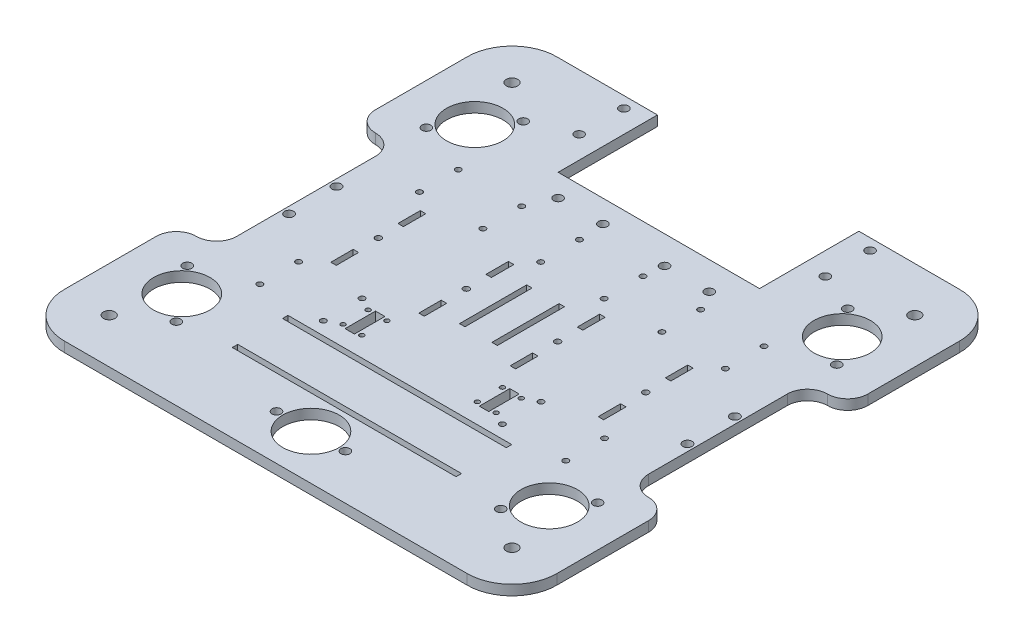
from build123d import *

# Parameters (mm, degrees)
SKETCH1_W                              = 279.4
SKETCH1_H                              = 279.4
BOSS_EXTRUDE1_DEPTH                    = 5.715
TAPE_SENSOR_CUTOUTS_CUT_EXTRUDE1_REACH = 199.648
SKETCH2_R                              = 1.2999974
SKETCH2_W                              = 5.334
SKETCH2_H                              = 17.272
WHEEL_WELLS_CUT_EXTRUDE2_REACH         = 199.648
SKETCH4_W                              = 22.86
SKETCH4_H                              = 101.6
FILLET1_START                          = -1
FILLET1_DEPTH                          = 8
FILLET1_2_DEPTH                        = 5.715
MOTOR_MOUNT_CUTOUTS_CUT_EXTRUDE3_REACH = 199.648
SKETCH5_W                              = 3.0988
SKETCH5_H                              = 12.7
SHAFT_HOLES_CUT_EXTRUDE4_REACH         = 199.648
SKETCH6_R                              = 3.2639
FILLET2_R                              = 25.4
COLLECTOR_CUTOUT_CUT_EXTRUDE5_REACH    = 199.648
SKETCH7_W                              = 114.3
SKETCH7_H                              = 56.388
F_6_0_204_DIAMETER_HOLE1_D             = 5.1816
M3_CLEARANCE_HOLE2_D                   = 3.4
CUT_EXTRUDE6_REACH                     = 199.648
SKETCH15_R                             = 2.54
SKETCH15_R_2                           = 16
SKETCH15_R_3                           = 16.000000004
CUT_EXTRUDE7_REACH                     = 199.648
SKETCH16_W                             = 3.0988
SKETCH16_H                             = 38.1
SKETCH19_R                             = 2.54
CUT_EXTRUDE8_DEPTH                     = 198.648276555
SKETCH20_R                             = 1.60655
SKETCH20_R_2                           = 1.59512
CUT_EXTRUDE9_DEPTH                     = 198.648276555
SKETCH25_W                             = 127
SKETCH25_H                             = 3.0988
CUT_EXTRUDE10_DEPTH                    = 198.648276555


with BuildPart() as part:
    # Sketch1 → Boss-Extrude1 (new body)
    with BuildSketch(Plane(origin=(0, 0, 0), x_dir=(1, 0, 0), z_dir=(0, 1, 0))):
        Rectangle(SKETCH1_W, SKETCH1_H)
    extrude(amount=BOSS_EXTRUDE1_DEPTH)

    # Sketch2 → TAPE_SENSOR_CUTOUTS_Cut-Extrude1 (cut, up to next)
    with BuildSketch(Plane(origin=(0, 5.715, 0), x_dir=(1, 0, 0), z_dir=(0, 1, 0)), mode=Mode.PRIVATE) as tape_sensor_cutouts_cut_extrude1_sk1:
        with Locations(Location((-43.434, -38.227, 0), (0, 0, 270))):
            Circle(SKETCH2_R)
    tape_sensor_cutouts_cut_extrude1_tool1 = extrude(tape_sensor_cutouts_cut_extrude1_sk1.sketch, amount=-TAPE_SENSOR_CUTOUTS_CUT_EXTRUDE1_REACH, mode=Mode.PRIVATE) & part.part
    # Sketch2 → TAPE_SENSOR_CUTOUTS_Cut-Extrude1 (cut, up to next)
    with BuildSketch(Plane(origin=(0, 5.715, 0), x_dir=(1, 0, 0), z_dir=(0, 1, 0)), mode=Mode.PRIVATE) as tape_sensor_cutouts_cut_extrude1_sk2:
        with Locations(Location((-32.766, -38.227, 0), (0, 0, 270))):
            Circle(SKETCH2_R)
    tape_sensor_cutouts_cut_extrude1_tool2 = extrude(tape_sensor_cutouts_cut_extrude1_sk2.sketch, amount=-TAPE_SENSOR_CUTOUTS_CUT_EXTRUDE1_REACH, mode=Mode.PRIVATE) & part.part
    # Sketch2 → TAPE_SENSOR_CUTOUTS_Cut-Extrude1 (cut, up to next)
    with BuildSketch(Plane(origin=(0, 5.715, 0), x_dir=(1, 0, 0), z_dir=(0, 1, 0)), mode=Mode.PRIVATE) as tape_sensor_cutouts_cut_extrude1_sk3:
        with Locations(Location((-32.766, -52.451, 0), (0, 0, 270))):
            Circle(SKETCH2_R)
    tape_sensor_cutouts_cut_extrude1_tool3 = extrude(tape_sensor_cutouts_cut_extrude1_sk3.sketch, amount=-TAPE_SENSOR_CUTOUTS_CUT_EXTRUDE1_REACH, mode=Mode.PRIVATE) & part.part
    # Sketch2 → TAPE_SENSOR_CUTOUTS_Cut-Extrude1 (cut, up to next)
    with BuildSketch(Plane(origin=(0, 5.715, 0), x_dir=(1, 0, 0), z_dir=(0, 1, 0)), mode=Mode.PRIVATE) as tape_sensor_cutouts_cut_extrude1_sk4:
        with Locations(Location((-43.434, -52.451, 0), (0, 0, 270))):
            Circle(SKETCH2_R)
    tape_sensor_cutouts_cut_extrude1_tool4 = extrude(tape_sensor_cutouts_cut_extrude1_sk4.sketch, amount=-TAPE_SENSOR_CUTOUTS_CUT_EXTRUDE1_REACH, mode=Mode.PRIVATE) & part.part
    # Sketch2 → TAPE_SENSOR_CUTOUTS_Cut-Extrude1 (cut, up to next)
    with BuildSketch(Plane(origin=(0, 5.715, 0), x_dir=(1, 0, 0), z_dir=(0, 1, 0)), mode=Mode.PRIVATE) as tape_sensor_cutouts_cut_extrude1_sk5:
        with Locations(Location((43.434, -52.451, 0), (0, 0, 270))):
            Circle(SKETCH2_R)
    tape_sensor_cutouts_cut_extrude1_tool5 = extrude(tape_sensor_cutouts_cut_extrude1_sk5.sketch, amount=-TAPE_SENSOR_CUTOUTS_CUT_EXTRUDE1_REACH, mode=Mode.PRIVATE) & part.part
    # Sketch2 → TAPE_SENSOR_CUTOUTS_Cut-Extrude1 (cut, up to next)
    with BuildSketch(Plane(origin=(0, 5.715, 0), x_dir=(1, 0, 0), z_dir=(0, 1, 0)), mode=Mode.PRIVATE) as tape_sensor_cutouts_cut_extrude1_sk6:
        with Locations(Location((32.766, -52.451, 0), (0, 0, 270))):
            Circle(SKETCH2_R)
    tape_sensor_cutouts_cut_extrude1_tool6 = extrude(tape_sensor_cutouts_cut_extrude1_sk6.sketch, amount=-TAPE_SENSOR_CUTOUTS_CUT_EXTRUDE1_REACH, mode=Mode.PRIVATE) & part.part
    # Sketch2 → TAPE_SENSOR_CUTOUTS_Cut-Extrude1 (cut, up to next)
    with BuildSketch(Plane(origin=(0, 5.715, 0), x_dir=(1, 0, 0), z_dir=(0, 1, 0)), mode=Mode.PRIVATE) as tape_sensor_cutouts_cut_extrude1_sk7:
        with Locations(Location((32.766, -38.227, 0), (0, 0, 270))):
            Circle(SKETCH2_R)
    tape_sensor_cutouts_cut_extrude1_tool7 = extrude(tape_sensor_cutouts_cut_extrude1_sk7.sketch, amount=-TAPE_SENSOR_CUTOUTS_CUT_EXTRUDE1_REACH, mode=Mode.PRIVATE) & part.part
    # Sketch2 → TAPE_SENSOR_CUTOUTS_Cut-Extrude1 (cut, up to next)
    with BuildSketch(Plane(origin=(0, 5.715, 0), x_dir=(1, 0, 0), z_dir=(0, 1, 0)), mode=Mode.PRIVATE) as tape_sensor_cutouts_cut_extrude1_sk8:
        with Locations(Location((43.434, -38.227, 0), (0, 0, 270))):
            Circle(SKETCH2_R)
    tape_sensor_cutouts_cut_extrude1_tool8 = extrude(tape_sensor_cutouts_cut_extrude1_sk8.sketch, amount=-TAPE_SENSOR_CUTOUTS_CUT_EXTRUDE1_REACH, mode=Mode.PRIVATE) & part.part
    # Sketch2 → TAPE_SENSOR_CUTOUTS_Cut-Extrude1 (cut, up to next)
    with BuildSketch(Plane(origin=(0, 5.715, 0), x_dir=(1, 0, 0), z_dir=(0, 1, 0)), mode=Mode.PRIVATE) as tape_sensor_cutouts_cut_extrude1_sk9:
        with Locations((-38.1, -45.339)):
            Rectangle(SKETCH2_W, SKETCH2_H)
    tape_sensor_cutouts_cut_extrude1_tool9 = extrude(tape_sensor_cutouts_cut_extrude1_sk9.sketch, amount=-TAPE_SENSOR_CUTOUTS_CUT_EXTRUDE1_REACH, mode=Mode.PRIVATE) & part.part
    # Sketch2 → TAPE_SENSOR_CUTOUTS_Cut-Extrude1 (cut, up to next)
    with BuildSketch(Plane(origin=(0, 5.715, 0), x_dir=(1, 0, 0), z_dir=(0, 1, 0)), mode=Mode.PRIVATE) as tape_sensor_cutouts_cut_extrude1_sk10:
        with Locations((38.1, -45.339)):
            Rectangle(SKETCH2_W, SKETCH2_H)
    tape_sensor_cutouts_cut_extrude1_tool10 = extrude(tape_sensor_cutouts_cut_extrude1_sk10.sketch, amount=-TAPE_SENSOR_CUTOUTS_CUT_EXTRUDE1_REACH, mode=Mode.PRIVATE) & part.part
    add(tape_sensor_cutouts_cut_extrude1_tool1.solids().sort_by_distance((-43.434, 5.715, 38.227))[0], mode=Mode.SUBTRACT)
    add(tape_sensor_cutouts_cut_extrude1_tool2.solids().sort_by_distance((-32.766, 5.715, 38.227))[0], mode=Mode.SUBTRACT)
    add(tape_sensor_cutouts_cut_extrude1_tool3.solids().sort_by_distance((-32.766, 5.715, 52.451))[0], mode=Mode.SUBTRACT)
    add(tape_sensor_cutouts_cut_extrude1_tool4.solids().sort_by_distance((-43.434, 5.715, 52.451))[0], mode=Mode.SUBTRACT)
    add(tape_sensor_cutouts_cut_extrude1_tool5.solids().sort_by_distance((43.434, 5.715, 52.451))[0], mode=Mode.SUBTRACT)
    add(tape_sensor_cutouts_cut_extrude1_tool6.solids().sort_by_distance((32.766, 5.715, 52.451))[0], mode=Mode.SUBTRACT)
    add(tape_sensor_cutouts_cut_extrude1_tool7.solids().sort_by_distance((32.766, 5.715, 38.227))[0], mode=Mode.SUBTRACT)
    add(tape_sensor_cutouts_cut_extrude1_tool8.solids().sort_by_distance((43.434, 5.715, 38.227))[0], mode=Mode.SUBTRACT)
    add(tape_sensor_cutouts_cut_extrude1_tool9.solids().sort_by_distance((-38.1, 5.715, 45.339))[0], mode=Mode.SUBTRACT)
    add(tape_sensor_cutouts_cut_extrude1_tool10.solids().sort_by_distance((38.1, 5.715, 45.339))[0], mode=Mode.SUBTRACT)

    # Sketch4 → WHEEL_WELLS_Cut-Extrude2 (cut, up to next)
    with BuildSketch(Plane(origin=(0, 5.715, 0), x_dir=(1, 0, 0), z_dir=(0, 1, 0)), mode=Mode.PRIVATE) as wheel_wells_cut_extrude2_sk1:
        with Locations((-128.27, 0)):
            Rectangle(SKETCH4_W, SKETCH4_H)
    wheel_wells_cut_extrude2_tool1 = extrude(wheel_wells_cut_extrude2_sk1.sketch, amount=-WHEEL_WELLS_CUT_EXTRUDE2_REACH, mode=Mode.PRIVATE) & part.part
    # Sketch4 → WHEEL_WELLS_Cut-Extrude2 (cut, up to next)
    with BuildSketch(Plane(origin=(0, 5.715, 0), x_dir=(1, 0, 0), z_dir=(0, 1, 0)), mode=Mode.PRIVATE) as wheel_wells_cut_extrude2_sk2:
        with Locations((128.27, 0)):
            Rectangle(SKETCH4_W, SKETCH4_H)
    wheel_wells_cut_extrude2_tool2 = extrude(wheel_wells_cut_extrude2_sk2.sketch, amount=-WHEEL_WELLS_CUT_EXTRUDE2_REACH, mode=Mode.PRIVATE) & part.part
    add(wheel_wells_cut_extrude2_tool1.solids().sort_by_distance((-128.27, 5.715, 0))[0], mode=Mode.SUBTRACT)
    add(wheel_wells_cut_extrude2_tool2.solids().sort_by_distance((128.27, 5.715, 0))[0], mode=Mode.SUBTRACT)

    # Fillet1: read off the stored shape, not the designer's step
    # Fillet1 outline → Fillet1 (cut)
    with BuildSketch(Plane(origin=(0, 0, 0), x_dir=(1, 0, 0), z_dir=(0, 1, 0)).offset(FILLET1_START)):
        with BuildLine():
            ThreePointArc((-139.7, -62.23), (-136.352230509, -54.147769491), (-128.27, -50.8))
            Line((-128.27, -50.8), (-139.7, -50.8))
            Line((-139.7, -50.8), (-139.7, -62.23))
        make_face()
        with BuildLine():
            ThreePointArc((-128.27, 50.8), (-136.352230509, 54.147769491), (-139.7, 62.23))
            Line((-139.7, 62.23), (-139.7, 50.8))
            Line((-139.7, 50.8), (-128.27, 50.8))
        make_face()
        with BuildLine():
            Line((139.7, -50.8), (128.27, -50.8))
            ThreePointArc((128.27, -50.8), (136.352230509, -54.147769491), (139.7, -62.23))
            Line((139.7, -62.23), (139.7, -50.8))
        make_face()
        with BuildLine():
            ThreePointArc((139.7, 62.23), (136.352230509, 54.147769491), (128.27, 50.8))
            Line((128.27, 50.8), (139.7, 50.8))
            Line((139.7, 50.8), (139.7, 62.23))
        make_face()
    extrude(amount=FILLET1_DEPTH, mode=Mode.SUBTRACT)

    # Fillet1 2 outline → Fillet1 2 (add)
    with BuildSketch(Plane(origin=(0, 0, 0), x_dir=(1, 0, 0), z_dir=(0, 1, 0))):
        with BuildLine():
            Line((-116.84, -50.8), (-116.84, -39.37))
            ThreePointArc((-116.84, -39.37), (-120.187769491, -47.452230509), (-128.27, -50.8))
            Line((-128.27, -50.8), (-116.84, -50.8))
        make_face()
        with BuildLine():
            Line((-116.84, 50.8), (-128.27, 50.8))
            ThreePointArc((-128.27, 50.8), (-120.187769491, 47.452230509), (-116.84, 39.37))
            Line((-116.84, 39.37), (-116.84, 50.8))
        make_face()
        with BuildLine():
            Line((116.84, -50.8), (128.27, -50.8))
            ThreePointArc((128.27, -50.8), (120.187769491, -47.452230509), (116.84, -39.37))
            Line((116.84, -39.37), (116.84, -50.8))
        make_face()
        with BuildLine():
            Line((116.84, 50.8), (116.84, 39.37))
            ThreePointArc((116.84, 39.37), (120.187769491, 47.452230509), (128.27, 50.8))
            Line((128.27, 50.8), (116.84, 50.8))
        make_face()
    extrude(amount=FILLET1_2_DEPTH)

    # Sketch5 → MOTOR_MOUNT_CUTOUTS_Cut-Extrude3 (cut, up to next)
    with BuildSketch(Plane(origin=(0, 0, 0), x_dir=(-1, 0, 0), z_dir=(0, -1, 0)), mode=Mode.PRIVATE) as motor_mount_cutouts_cut_extrude3_sk1:
        with Locations((75.8825, -19.05)):
            Rectangle(SKETCH5_W, SKETCH5_H)
    motor_mount_cutouts_cut_extrude3_tool1 = extrude(motor_mount_cutouts_cut_extrude3_sk1.sketch, amount=-MOTOR_MOUNT_CUTOUTS_CUT_EXTRUDE3_REACH, mode=Mode.PRIVATE) & part.part
    # Sketch5 → MOTOR_MOUNT_CUTOUTS_Cut-Extrude3 (cut, up to next)
    with BuildSketch(Plane(origin=(0, 0, 0), x_dir=(-1, 0, 0), z_dir=(0, -1, 0)), mode=Mode.PRIVATE) as motor_mount_cutouts_cut_extrude3_sk2:
        with Locations((75.8825, 19.05)):
            Rectangle(SKETCH5_W, SKETCH5_H)
    motor_mount_cutouts_cut_extrude3_tool2 = extrude(motor_mount_cutouts_cut_extrude3_sk2.sketch, amount=-MOTOR_MOUNT_CUTOUTS_CUT_EXTRUDE3_REACH, mode=Mode.PRIVATE) & part.part
    # Sketch5 → MOTOR_MOUNT_CUTOUTS_Cut-Extrude3 (cut, up to next)
    with BuildSketch(Plane(origin=(0, 0, 0), x_dir=(-1, 0, 0), z_dir=(0, -1, 0)), mode=Mode.PRIVATE) as motor_mount_cutouts_cut_extrude3_sk3:
        with Locations((-75.8825, 19.05)):
            Rectangle(SKETCH5_W, SKETCH5_H)
    motor_mount_cutouts_cut_extrude3_tool3 = extrude(motor_mount_cutouts_cut_extrude3_sk3.sketch, amount=-MOTOR_MOUNT_CUTOUTS_CUT_EXTRUDE3_REACH, mode=Mode.PRIVATE) & part.part
    # Sketch5 → MOTOR_MOUNT_CUTOUTS_Cut-Extrude3 (cut, up to next)
    with BuildSketch(Plane(origin=(0, 0, 0), x_dir=(-1, 0, 0), z_dir=(0, -1, 0)), mode=Mode.PRIVATE) as motor_mount_cutouts_cut_extrude3_sk4:
        with Locations((-75.8825, -19.05)):
            Rectangle(SKETCH5_W, SKETCH5_H)
    motor_mount_cutouts_cut_extrude3_tool4 = extrude(motor_mount_cutouts_cut_extrude3_sk4.sketch, amount=-MOTOR_MOUNT_CUTOUTS_CUT_EXTRUDE3_REACH, mode=Mode.PRIVATE) & part.part
    # Sketch5 → MOTOR_MOUNT_CUTOUTS_Cut-Extrude3 (cut, up to next)
    with BuildSketch(Plane(origin=(0, 0, 0), x_dir=(-1, 0, 0), z_dir=(0, -1, 0)), mode=Mode.PRIVATE) as motor_mount_cutouts_cut_extrude3_sk5:
        with Locations((25.908, -19.05)):
            Rectangle(SKETCH5_W, SKETCH5_H)
    motor_mount_cutouts_cut_extrude3_tool5 = extrude(motor_mount_cutouts_cut_extrude3_sk5.sketch, amount=-MOTOR_MOUNT_CUTOUTS_CUT_EXTRUDE3_REACH, mode=Mode.PRIVATE) & part.part
    # Sketch5 → MOTOR_MOUNT_CUTOUTS_Cut-Extrude3 (cut, up to next)
    with BuildSketch(Plane(origin=(0, 0, 0), x_dir=(-1, 0, 0), z_dir=(0, -1, 0)), mode=Mode.PRIVATE) as motor_mount_cutouts_cut_extrude3_sk6:
        with Locations((25.908, 19.05)):
            Rectangle(SKETCH5_W, SKETCH5_H)
    motor_mount_cutouts_cut_extrude3_tool6 = extrude(motor_mount_cutouts_cut_extrude3_sk6.sketch, amount=-MOTOR_MOUNT_CUTOUTS_CUT_EXTRUDE3_REACH, mode=Mode.PRIVATE) & part.part
    # Sketch5 → MOTOR_MOUNT_CUTOUTS_Cut-Extrude3 (cut, up to next)
    with BuildSketch(Plane(origin=(0, 0, 0), x_dir=(-1, 0, 0), z_dir=(0, -1, 0)), mode=Mode.PRIVATE) as motor_mount_cutouts_cut_extrude3_sk7:
        with Locations((-25.908, 19.05)):
            Rectangle(SKETCH5_W, SKETCH5_H)
    motor_mount_cutouts_cut_extrude3_tool7 = extrude(motor_mount_cutouts_cut_extrude3_sk7.sketch, amount=-MOTOR_MOUNT_CUTOUTS_CUT_EXTRUDE3_REACH, mode=Mode.PRIVATE) & part.part
    # Sketch5 → MOTOR_MOUNT_CUTOUTS_Cut-Extrude3 (cut, up to next)
    with BuildSketch(Plane(origin=(0, 0, 0), x_dir=(-1, 0, 0), z_dir=(0, -1, 0)), mode=Mode.PRIVATE) as motor_mount_cutouts_cut_extrude3_sk8:
        with Locations((-25.908, -19.05)):
            Rectangle(SKETCH5_W, SKETCH5_H)
    motor_mount_cutouts_cut_extrude3_tool8 = extrude(motor_mount_cutouts_cut_extrude3_sk8.sketch, amount=-MOTOR_MOUNT_CUTOUTS_CUT_EXTRUDE3_REACH, mode=Mode.PRIVATE) & part.part
    add(motor_mount_cutouts_cut_extrude3_tool1.solids().sort_by_distance((-75.8825, 0, 19.05))[0], mode=Mode.SUBTRACT)
    add(motor_mount_cutouts_cut_extrude3_tool2.solids().sort_by_distance((-75.8825, 0, -19.05))[0], mode=Mode.SUBTRACT)
    add(motor_mount_cutouts_cut_extrude3_tool3.solids().sort_by_distance((75.8825, 0, -19.05))[0], mode=Mode.SUBTRACT)
    add(motor_mount_cutouts_cut_extrude3_tool4.solids().sort_by_distance((75.8825, 0, 19.05))[0], mode=Mode.SUBTRACT)
    add(motor_mount_cutouts_cut_extrude3_tool5.solids().sort_by_distance((-25.908, 0, 19.05))[0], mode=Mode.SUBTRACT)
    add(motor_mount_cutouts_cut_extrude3_tool6.solids().sort_by_distance((-25.908, 0, -19.05))[0], mode=Mode.SUBTRACT)
    add(motor_mount_cutouts_cut_extrude3_tool7.solids().sort_by_distance((25.908, 0, -19.05))[0], mode=Mode.SUBTRACT)
    add(motor_mount_cutouts_cut_extrude3_tool8.solids().sort_by_distance((25.908, 0, 19.05))[0], mode=Mode.SUBTRACT)

    # Sketch6 → SHAFT_HOLES_Cut-Extrude4 (cut, up to next)
    with BuildSketch(Plane(origin=(0, 5.715, 0), x_dir=(1, 0, 0), z_dir=(0, 1, 0)), mode=Mode.PRIVATE) as shaft_holes_cut_extrude4_sk1:
        with Locations(Location((-114.3, 114.3, 0), (0, 0, 270))):
            Circle(SKETCH6_R)
    shaft_holes_cut_extrude4_tool1 = extrude(shaft_holes_cut_extrude4_sk1.sketch, amount=-SHAFT_HOLES_CUT_EXTRUDE4_REACH, mode=Mode.PRIVATE) & part.part
    # Sketch6 → SHAFT_HOLES_Cut-Extrude4 (cut, up to next)
    with BuildSketch(Plane(origin=(0, 5.715, 0), x_dir=(1, 0, 0), z_dir=(0, 1, 0)), mode=Mode.PRIVATE) as shaft_holes_cut_extrude4_sk2:
        with Locations(Location((114.3, 114.3, 0), (0, 0, 270))):
            Circle(SKETCH6_R)
    shaft_holes_cut_extrude4_tool2 = extrude(shaft_holes_cut_extrude4_sk2.sketch, amount=-SHAFT_HOLES_CUT_EXTRUDE4_REACH, mode=Mode.PRIVATE) & part.part
    # Sketch6 → SHAFT_HOLES_Cut-Extrude4 (cut, up to next)
    with BuildSketch(Plane(origin=(0, 5.715, 0), x_dir=(1, 0, 0), z_dir=(0, 1, 0)), mode=Mode.PRIVATE) as shaft_holes_cut_extrude4_sk3:
        with Locations(Location((114.3, -114.3, 0), (0, 0, 270))):
            Circle(SKETCH6_R)
    shaft_holes_cut_extrude4_tool3 = extrude(shaft_holes_cut_extrude4_sk3.sketch, amount=-SHAFT_HOLES_CUT_EXTRUDE4_REACH, mode=Mode.PRIVATE) & part.part
    # Sketch6 → SHAFT_HOLES_Cut-Extrude4 (cut, up to next)
    with BuildSketch(Plane(origin=(0, 5.715, 0), x_dir=(1, 0, 0), z_dir=(0, 1, 0)), mode=Mode.PRIVATE) as shaft_holes_cut_extrude4_sk4:
        with Locations(Location((-114.3, -114.3, 0), (0, 0, 270))):
            Circle(SKETCH6_R)
    shaft_holes_cut_extrude4_tool4 = extrude(shaft_holes_cut_extrude4_sk4.sketch, amount=-SHAFT_HOLES_CUT_EXTRUDE4_REACH, mode=Mode.PRIVATE) & part.part
    add(shaft_holes_cut_extrude4_tool1.solids().sort_by_distance((-114.3, 5.715, -114.3))[0], mode=Mode.SUBTRACT)
    add(shaft_holes_cut_extrude4_tool2.solids().sort_by_distance((114.3, 5.715, -114.3))[0], mode=Mode.SUBTRACT)
    add(shaft_holes_cut_extrude4_tool3.solids().sort_by_distance((114.3, 5.715, 114.3))[0], mode=Mode.SUBTRACT)
    add(shaft_holes_cut_extrude4_tool4.solids().sort_by_distance((-114.3, 5.715, 114.3))[0], mode=Mode.SUBTRACT)

    # Fillet2
    fillet2_edges = [part.edges().sort_by_distance(p)[0] for p in [
        (-139.7, 2.8575, -139.7),
        (139.7, 2.8575, -139.7),
        (139.7, 2.8575, 139.7),
        (-139.7, 2.8575, 139.7),
    ]]
    fillet(fillet2_edges, radius=FILLET2_R)

    # Sketch7 → COLLECTOR_CUTOUT_Cut-Extrude5 (cut, up to next)
    with BuildSketch(Plane(origin=(0, 5.715, 0), x_dir=(1, 0, 0), z_dir=(0, 1, 0)), mode=Mode.PRIVATE) as collector_cutout_cut_extrude5_sk1:
        with Locations((0, 111.506)):
            Rectangle(SKETCH7_W, SKETCH7_H)
    collector_cutout_cut_extrude5_tool1 = extrude(collector_cutout_cut_extrude5_sk1.sketch, amount=-COLLECTOR_CUTOUT_CUT_EXTRUDE5_REACH, mode=Mode.PRIVATE) & part.part
    add(collector_cutout_cut_extrude5_tool1.solids().sort_by_distance((0, 5.715, -111.506))[0], mode=Mode.SUBTRACT)

    # #6 (0.204) Diameter Hole1 (through all)
    with Locations(Plane(origin=(0, 5.715, 0), x_dir=(1, 0, 0), z_dir=(0, 1, 0))):
        with Locations((-113.03, 13.462), (-113.03, -13.462), (113.03, 13.462), (113.03, -13.462)):
            Hole(F_6_0_204_DIAMETER_HOLE1_D / 2)

    # M3 Clearance Hole2 (through all)
    with Locations(Plane(origin=(0, 5.715, 0), x_dir=(1, 0, 0), z_dir=(0, 1, 0))):
        with Locations((-75.8825, 0), (-25.908, 0), (25.908, 0), (75.8825, 0)):
            Hole(M3_CLEARANCE_HOLE2_D / 2)

    # Sketch15 → Cut-Extrude6 (cut, up to next)
    with BuildSketch(Plane(origin=(0, 5.715, 0), x_dir=(1, 0, 0), z_dir=(0, 1, 0)), mode=Mode.PRIVATE) as cut_extrude6_sk1:
        with Locations(Location((-116.451441732, -67.851304944, 0), (0, 0, 270))):
            Circle(SKETCH15_R)
    cut_extrude6_tool1 = extrude(cut_extrude6_sk1.sketch, amount=-CUT_EXTRUDE6_REACH, mode=Mode.PRIVATE) & part.part
    # Sketch15 → Cut-Extrude6 (cut, up to next)
    with BuildSketch(Plane(origin=(0, 5.715, 0), x_dir=(1, 0, 0), z_dir=(0, 1, 0)), mode=Mode.PRIVATE) as cut_extrude6_sk2:
        with Locations(Location((-104.257228187, -83.142365078, 0), (0, 0, 270))):
            Circle(SKETCH15_R_2)
    cut_extrude6_tool2 = extrude(cut_extrude6_sk2.sketch, amount=-CUT_EXTRUDE6_REACH, mode=Mode.PRIVATE) & part.part
    # Sketch15 → Cut-Extrude6 (cut, up to next)
    with BuildSketch(Plane(origin=(0, 5.715, 0), x_dir=(1, 0, 0), z_dir=(0, 1, 0)), mode=Mode.PRIVATE) as cut_extrude6_sk3:
        with Locations(Location((-92.063014642, -98.433425212, 0), (0, 0, 270))):
            Circle(SKETCH15_R)
    cut_extrude6_tool3 = extrude(cut_extrude6_sk3.sketch, amount=-CUT_EXTRUDE6_REACH, mode=Mode.PRIVATE) & part.part
    # Sketch15 → Cut-Extrude6 (cut, up to next)
    with BuildSketch(Plane(origin=(0, 5.715, 0), x_dir=(1, 0, 0), z_dir=(0, 1, 0)), mode=Mode.PRIVATE) as cut_extrude6_sk4:
        with Locations(Location((-92.063014642, 98.433425212, 0), (0, 0, 270))):
            Circle(SKETCH15_R)
    cut_extrude6_tool4 = extrude(cut_extrude6_sk4.sketch, amount=-CUT_EXTRUDE6_REACH, mode=Mode.PRIVATE) & part.part
    # Sketch15 → Cut-Extrude6 (cut, up to next)
    with BuildSketch(Plane(origin=(0, 5.715, 0), x_dir=(1, 0, 0), z_dir=(0, 1, 0)), mode=Mode.PRIVATE) as cut_extrude6_sk5:
        with Locations(Location((-104.257228187, 83.142365078, 0), (0, 0, 270))):
            Circle(SKETCH15_R_2)
    cut_extrude6_tool5 = extrude(cut_extrude6_sk5.sketch, amount=-CUT_EXTRUDE6_REACH, mode=Mode.PRIVATE) & part.part
    # Sketch15 → Cut-Extrude6 (cut, up to next)
    with BuildSketch(Plane(origin=(0, 5.715, 0), x_dir=(1, 0, 0), z_dir=(0, 1, 0)), mode=Mode.PRIVATE) as cut_extrude6_sk6:
        with Locations(Location((-116.451441732, 67.851304944, 0), (0, 0, 270))):
            Circle(SKETCH15_R)
    cut_extrude6_tool6 = extrude(cut_extrude6_sk6.sketch, amount=-CUT_EXTRUDE6_REACH, mode=Mode.PRIVATE) & part.part
    # Sketch15 → Cut-Extrude6 (cut, up to next)
    with BuildSketch(Plane(origin=(0, 5.715, 0), x_dir=(1, 0, 0), z_dir=(0, 1, 0)), mode=Mode.PRIVATE) as cut_extrude6_sk7:
        with Locations(Location((116.451441732, 67.851304944, 0), (0, 0, 270))):
            Circle(SKETCH15_R)
    cut_extrude6_tool7 = extrude(cut_extrude6_sk7.sketch, amount=-CUT_EXTRUDE6_REACH, mode=Mode.PRIVATE) & part.part
    # Sketch15 → Cut-Extrude6 (cut, up to next)
    with BuildSketch(Plane(origin=(0, 5.715, 0), x_dir=(1, 0, 0), z_dir=(0, 1, 0)), mode=Mode.PRIVATE) as cut_extrude6_sk8:
        with Locations(Location((104.257228187, 83.142365078, 0), (0, 0, 270))):
            Circle(SKETCH15_R_2)
    cut_extrude6_tool8 = extrude(cut_extrude6_sk8.sketch, amount=-CUT_EXTRUDE6_REACH, mode=Mode.PRIVATE) & part.part
    # Sketch15 → Cut-Extrude6 (cut, up to next)
    with BuildSketch(Plane(origin=(0, 5.715, 0), x_dir=(1, 0, 0), z_dir=(0, 1, 0)), mode=Mode.PRIVATE) as cut_extrude6_sk9:
        with Locations(Location((92.063014642, 98.433425212, 0), (0, 0, 270))):
            Circle(SKETCH15_R)
    cut_extrude6_tool9 = extrude(cut_extrude6_sk9.sketch, amount=-CUT_EXTRUDE6_REACH, mode=Mode.PRIVATE) & part.part
    # Sketch15 → Cut-Extrude6 (cut, up to next)
    with BuildSketch(Plane(origin=(0, 5.715, 0), x_dir=(1, 0, 0), z_dir=(0, 1, 0)), mode=Mode.PRIVATE) as cut_extrude6_sk10:
        with Locations(Location((92.063014642, -98.433425212, 0), (0, 0, 270))):
            Circle(SKETCH15_R)
    cut_extrude6_tool10 = extrude(cut_extrude6_sk10.sketch, amount=-CUT_EXTRUDE6_REACH, mode=Mode.PRIVATE) & part.part
    # Sketch15 → Cut-Extrude6 (cut, up to next)
    with BuildSketch(Plane(origin=(0, 5.715, 0), x_dir=(1, 0, 0), z_dir=(0, 1, 0)), mode=Mode.PRIVATE) as cut_extrude6_sk11:
        with Locations(Location((104.257228187, -83.142365078, 0), (0, 0, 270))):
            Circle(SKETCH15_R_2)
    cut_extrude6_tool11 = extrude(cut_extrude6_sk11.sketch, amount=-CUT_EXTRUDE6_REACH, mode=Mode.PRIVATE) & part.part
    # Sketch15 → Cut-Extrude6 (cut, up to next)
    with BuildSketch(Plane(origin=(0, 5.715, 0), x_dir=(1, 0, 0), z_dir=(0, 1, 0)), mode=Mode.PRIVATE) as cut_extrude6_sk12:
        with Locations(Location((116.451441732, -67.851304944, 0), (0, 0, 270))):
            Circle(SKETCH15_R)
    cut_extrude6_tool12 = extrude(cut_extrude6_sk12.sketch, amount=-CUT_EXTRUDE6_REACH, mode=Mode.PRIVATE) & part.part
    # Sketch15 → Cut-Extrude6 (cut, up to next)
    with BuildSketch(Plane(origin=(0, 5.715, 0), x_dir=(1, 0, 0), z_dir=(0, 1, 0)), mode=Mode.PRIVATE) as cut_extrude6_sk13:
        with Locations(Location((-19.558, -114.092780833, 0), (0, 0, 270))):
            Circle(SKETCH15_R)
    cut_extrude6_tool13 = extrude(cut_extrude6_sk13.sketch, amount=-CUT_EXTRUDE6_REACH, mode=Mode.PRIVATE) & part.part
    # Sketch15 → Cut-Extrude6 (cut, up to next)
    with BuildSketch(Plane(origin=(0, 5.715, 0), x_dir=(1, 0, 0), z_dir=(0, 1, 0)), mode=Mode.PRIVATE) as cut_extrude6_sk14:
        with Locations(Location((19.558, -114.092780833, 0), (0, 0, 270))):
            Circle(SKETCH15_R)
    cut_extrude6_tool14 = extrude(cut_extrude6_sk14.sketch, amount=-CUT_EXTRUDE6_REACH, mode=Mode.PRIVATE) & part.part
    # Sketch15 → Cut-Extrude6 (cut, up to next)
    with BuildSketch(Plane(origin=(0, 5.715, 0), x_dir=(1, 0, 0), z_dir=(0, 1, 0)), mode=Mode.PRIVATE) as cut_extrude6_sk15:
        with Locations(Location((0, -114.092780833, 0), (0, 0, 270))):
            Circle(SKETCH15_R_3)
    cut_extrude6_tool15 = extrude(cut_extrude6_sk15.sketch, amount=-CUT_EXTRUDE6_REACH, mode=Mode.PRIVATE) & part.part
    add(cut_extrude6_tool1.solids().sort_by_distance((-116.451442, 5.715, 67.851305))[0], mode=Mode.SUBTRACT)
    add(cut_extrude6_tool2.solids().sort_by_distance((-104.257228, 5.715, 83.142365))[0], mode=Mode.SUBTRACT)
    add(cut_extrude6_tool3.solids().sort_by_distance((-92.063015, 5.715, 98.433425))[0], mode=Mode.SUBTRACT)
    add(cut_extrude6_tool4.solids().sort_by_distance((-92.063015, 5.715, -98.433425))[0], mode=Mode.SUBTRACT)
    add(cut_extrude6_tool5.solids().sort_by_distance((-104.257228, 5.715, -83.142365))[0], mode=Mode.SUBTRACT)
    add(cut_extrude6_tool6.solids().sort_by_distance((-116.451442, 5.715, -67.851305))[0], mode=Mode.SUBTRACT)
    add(cut_extrude6_tool7.solids().sort_by_distance((116.451442, 5.715, -67.851305))[0], mode=Mode.SUBTRACT)
    add(cut_extrude6_tool8.solids().sort_by_distance((104.257228, 5.715, -83.142365))[0], mode=Mode.SUBTRACT)
    add(cut_extrude6_tool9.solids().sort_by_distance((92.063015, 5.715, -98.433425))[0], mode=Mode.SUBTRACT)
    add(cut_extrude6_tool10.solids().sort_by_distance((92.063015, 5.715, 98.433425))[0], mode=Mode.SUBTRACT)
    add(cut_extrude6_tool11.solids().sort_by_distance((104.257228, 5.715, 83.142365))[0], mode=Mode.SUBTRACT)
    add(cut_extrude6_tool12.solids().sort_by_distance((116.451442, 5.715, 67.851305))[0], mode=Mode.SUBTRACT)
    add(cut_extrude6_tool13.solids().sort_by_distance((-19.558, 5.715, 114.092781))[0], mode=Mode.SUBTRACT)
    add(cut_extrude6_tool14.solids().sort_by_distance((19.558, 5.715, 114.092781))[0], mode=Mode.SUBTRACT)
    add(cut_extrude6_tool15.solids().sort_by_distance((0, 5.715, 114.092781))[0], mode=Mode.SUBTRACT)

    # Sketch16 → Cut-Extrude7 (cut, up to next)
    with BuildSketch(Plane(origin=(0, 5.715, 0), x_dir=(1, 0, 0), z_dir=(0, 1, 0)), mode=Mode.PRIVATE) as cut_extrude7_sk1:
        with Locations((-9.1948, 0)):
            Rectangle(SKETCH16_W, SKETCH16_H)
    cut_extrude7_tool1 = extrude(cut_extrude7_sk1.sketch, amount=-CUT_EXTRUDE7_REACH, mode=Mode.PRIVATE) & part.part
    # Sketch16 → Cut-Extrude7 (cut, up to next)
    with BuildSketch(Plane(origin=(0, 5.715, 0), x_dir=(1, 0, 0), z_dir=(0, 1, 0)), mode=Mode.PRIVATE) as cut_extrude7_sk2:
        with Locations((9.1948, 0)):
            Rectangle(SKETCH16_W, SKETCH16_H)
    cut_extrude7_tool2 = extrude(cut_extrude7_sk2.sketch, amount=-CUT_EXTRUDE7_REACH, mode=Mode.PRIVATE) & part.part
    add(cut_extrude7_tool1.solids().sort_by_distance((-9.1948, 5.715, 0))[0], mode=Mode.SUBTRACT)
    add(cut_extrude7_tool2.solids().sort_by_distance((9.1948, 5.715, 0))[0], mode=Mode.SUBTRACT)

    # Sketch19 → Cut-Extrude8 (cut, through all)
    with BuildSketch(Plane(origin=(0, 0, 0), x_dir=(1, 0, 0), z_dir=(0, 1, 0))):
        with Locations(Location((-44.45, 70.612, 0), (0, 0, 90))):
            Circle(SKETCH19_R)
        with Locations(Location((-19.05, 70.612, 0), (0, 0, 90))):
            Circle(SKETCH19_R)
        with Locations(Location((19.05, 67.5132, 0), (0, 0, 90))):
            Circle(SKETCH19_R)
        with Locations(Location((44.45, 67.5132, 0), (0, 0, 90))):
            Circle(SKETCH19_R)
        with Locations(Location((69.85, 133.35, 0), (0, 0, 90))):
            Circle(SKETCH19_R)
        with Locations(Location((69.85, 107.95, 0), (0, 0, 90))):
            Circle(SKETCH19_R)
        with Locations(Location((-69.85, 107.95, 0), (0, 0, 90))):
            Circle(SKETCH19_R)
        with Locations(Location((-69.85, 133.35, 0), (0, 0, 90))):
            Circle(SKETCH19_R)
    extrude(amount=CUT_EXTRUDE8_DEPTH, mode=Mode.SUBTRACT)

    # Sketch20 → Cut-Extrude9 (cut, through all)
    with BuildSketch(Plane(origin=(0, 5.715, 0), x_dir=(1, 0, 0), z_dir=(0, 1, 0))):
        with Locations(Location((-86.7918, 56.2864, 0), (0, 0, 270))):
            Circle(SKETCH20_R)
        with Locations(Location((-50.8, 56.2864, 0), (0, 0, 270))):
            Circle(SKETCH20_R)
        with Locations(Location((-50.8, 34.29, 0), (0, 0, 270))):
            Circle(SKETCH20_R_2)
        with Locations(Location((-86.7918, 34.29, 0), (0, 0, 270))):
            Circle(SKETCH20_R)
        with Locations(Location((86.7918, 34.29, 0), (0, 0, 90))):
            Circle(SKETCH20_R)
        with Locations(Location((50.8, 34.29, 0), (0, 0, 90))):
            Circle(SKETCH20_R_2)
        with Locations(Location((50.8, 56.2864, 0), (0, 0, 90))):
            Circle(SKETCH20_R)
        with Locations(Location((86.7918, 56.2864, 0), (0, 0, 90))):
            Circle(SKETCH20_R)
        with Locations(Location((86.7918, -56.2864, 0), (0, 0, 270))):
            Circle(SKETCH20_R)
        with Locations(Location((50.8, -56.2864, 0), (0, 0, 270))):
            Circle(SKETCH20_R)
        with Locations(Location((50.8, -34.29, 0), (0, 0, 270))):
            Circle(SKETCH20_R_2)
        with Locations(Location((86.7918, -34.29, 0), (0, 0, 270))):
            Circle(SKETCH20_R)
        with Locations(Location((-86.7918, -34.29, 0), (0, 0, 90))):
            Circle(SKETCH20_R)
        with Locations(Location((-50.8, -34.29, 0), (0, 0, 90))):
            Circle(SKETCH20_R_2)
        with Locations(Location((-50.8, -56.2864, 0), (0, 0, 90))):
            Circle(SKETCH20_R)
        with Locations(Location((-86.7918, -56.2864, 0), (0, 0, 90))):
            Circle(SKETCH20_R)
        with Locations(Location((-17.9959, 34.29, 0), (0, 0, 270))):
            Circle(SKETCH20_R)
        with Locations(Location((17.9959, 56.2864, 0), (0, 0, 270))):
            Circle(SKETCH20_R)
        with Locations(Location((17.9959, 34.29, 0), (0, 0, 270))):
            Circle(SKETCH20_R_2)
        with Locations(Location((-17.9959, 56.2864, 0), (0, 0, 270))):
            Circle(SKETCH20_R)
    extrude(amount=-CUT_EXTRUDE9_DEPTH, mode=Mode.SUBTRACT)

    # Sketch25 → Cut-Extrude10 (cut, through all)
    with BuildSketch(Plane(origin=(0, 5.715, 0), x_dir=(1, 0, 0), z_dir=(0, 1, 0))):
        with Locations((0, -93.7006)):
            Rectangle(SKETCH25_W, SKETCH25_H)
        with Locations((0, -65.2018)):
            Rectangle(SKETCH25_W, SKETCH25_H)
    extrude(amount=-CUT_EXTRUDE10_DEPTH, mode=Mode.SUBTRACT)


solid = part.part
